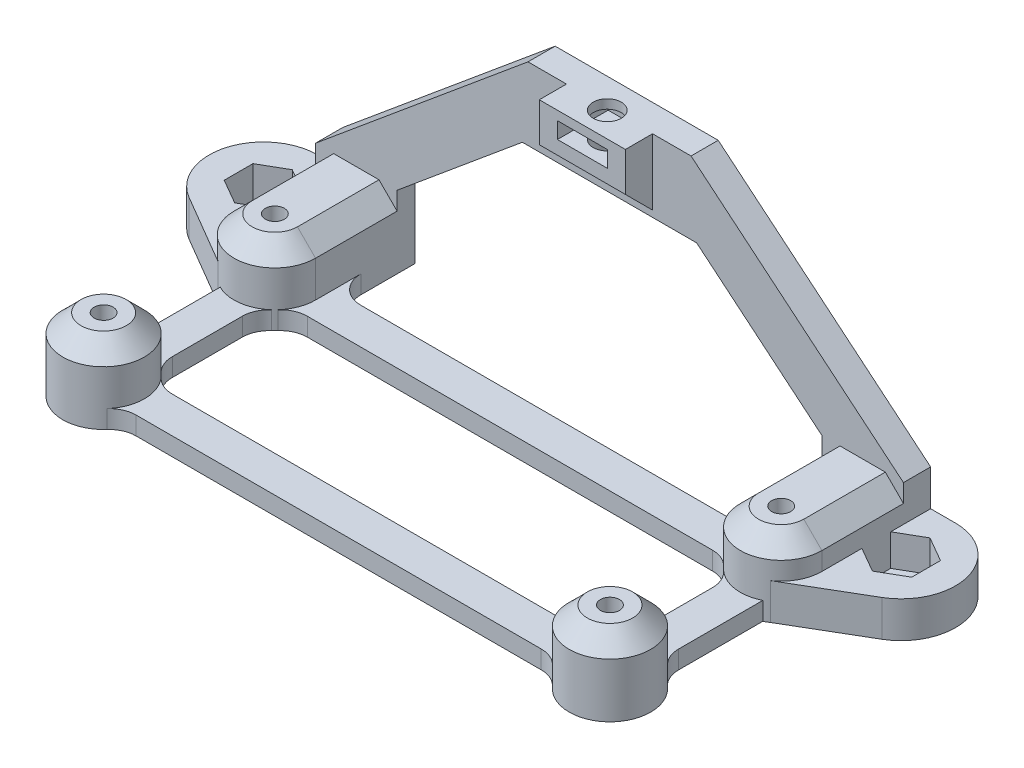
from build123d import *

# Parameters (mm, degrees)
SKETCH1_R             = 4.5
SKETCH1_R_2           = 1.05
BOSS_EXTRUDE1_DEPTH   = 8
BOSS_EXTRUDE1_2_DEPTH = 8
BOSS_EXTRUDE1_3_DEPTH = 8
BOSS_EXTRUDE1_4_DEPTH = 8
BOSS_EXTRUDE2_REACH   = 91.358
SKETCH2_W             = 3
SKETCH2_H             = 27.5
CUT_EXTRUDE1_DEPTH    = 54.46973443
SKETCH4_W             = 59.9
SKETCH4_H             = 22.9
SKETCH4_W_2           = 51.9
SKETCH4_H_2           = 14.9
BOSS_EXTRUDE3_DEPTH   = 2
SKETCH7_W             = 9.5
SKETCH7_H             = 3
BOSS_EXTRUDE5_DEPTH   = 4.3
CUT_EXTRUDE3_START    = -1
SKETCH8_W             = 5.5
SKETCH8_H             = 5.5
CUT_EXTRUDE3_DEPTH    = 1.8
CHAMFER3_SIZE         = 3
SKETCH9_R             = 1.55
CUT_EXTRUDE4_DEPTH    = 5.4
BOSS_EXTRUDE6_DEPTH   = 4
SKETCH11_R            = 1.5
BOSS_EXTRUDE7_DEPTH   = 0.5
FILLET2_R             = 3
CHAMFER4_SIZE         = 1
CHAMFER5_SIZE         = 2
SKETCH12_W            = 5.5
SKETCH12_H            = 1.8
CUT_EXTRUDE5_DEPTH    = 0.1


with BuildPart() as part:
    # Sketch1 → Boss-Extrude1 (new body)
    with BuildSketch(Plane(origin=(0, 0, 0), x_dir=(1, 0, 0), z_dir=(0, 1, 0))):
        with Locations(Location((27.95, -56.4, 0), (0, 0, 270))):
            Circle(SKETCH1_R)
        with Locations(Location((27.95, -56.4, 0), (0, 0, 270))):
            Circle(SKETCH1_R_2, mode=Mode.SUBTRACT)
    extrude(amount=BOSS_EXTRUDE1_DEPTH)



with BuildPart() as body_2:
    # Sketch1 → Boss-Extrude1 2 (new body)
    with BuildSketch(Plane(origin=(0, 0, 0), x_dir=(1, 0, 0), z_dir=(0, 1, 0))):
        with Locations(Location((-27.95, -56.4, 0), (0, 0, 270))):
            Circle(SKETCH1_R)
        with Locations(Location((-27.95, -56.4, 0), (0, 0, 270))):
            Circle(SKETCH1_R_2, mode=Mode.SUBTRACT)
    extrude(amount=BOSS_EXTRUDE1_2_DEPTH)


with BuildPart() as body_3:
    # Sketch1 → Boss-Extrude1 3 (new body)
    with BuildSketch(Plane(origin=(0, 0, 0), x_dir=(1, 0, 0), z_dir=(0, 1, 0))):
        with BuildLine():
            Line((-32.45, -37.5), (-32.45, -25.5))
            Line((-32.45, -25.5), (-23.45, -25.5))
            Line((-23.45, -25.5), (-23.45, -37.5))
            ThreePointArc((-23.45, -37.5), (-27.95, -42), (-32.45, -37.5))
        make_face()
        with Locations(Location((-27.95, -37.5, 0), (0, 0, 270))):
            Circle(SKETCH1_R_2, mode=Mode.SUBTRACT)
    extrude(amount=BOSS_EXTRUDE1_3_DEPTH)

    # Boss-Extrude2: up to this face of the body (flat: up to its plane)
    boss_extrude2_end = Plane(body_3.part.faces().sort_by_distance((-32.45, 4, 31.5))[0])
    # Sketch2 → Boss-Extrude2 (add, up to the picked face)
    with BuildSketch(Plane(origin=(32.45, 0, 0), x_dir=(0, 0, -1), z_dir=(1, 0, 0)), mode=Mode.PRIVATE) as boss_extrude2_sk1:
        with Locations((-27, 13.75)):
            Rectangle(SKETCH2_W, SKETCH2_H)
    boss_extrude2_tool1 = split(extrude(boss_extrude2_sk1.sketch, amount=-BOSS_EXTRUDE2_REACH, mode=Mode.PRIVATE), bisect_by=boss_extrude2_end, keep=Keep.BOTH, mode=Mode.PRIVATE)


with BuildPart() as body_4:
    # Sketch1 → Boss-Extrude1 4 (new body)
    with BuildSketch(Plane(origin=(0, 0, 0), x_dir=(1, 0, 0), z_dir=(0, 1, 0))):
        with BuildLine():
            Line((32.45, -37.5), (32.45, -25.5))
            Line((32.45, -25.5), (23.45, -25.5))
            Line((23.45, -25.5), (23.45, -37.5))
            ThreePointArc((23.45, -37.5), (27.95, -42), (32.45, -37.5))
        make_face()
        with Locations(Location((27.95, -37.5, 0), (0, 0, 270))):
            Circle(SKETCH1_R_2, mode=Mode.SUBTRACT)
    extrude(amount=BOSS_EXTRUDE1_4_DEPTH)


with BuildPart() as body_3_1:
    add(body_3.part)

    add(body_4.part)  # Boss-Extrude2 merges body 4
    add(boss_extrude2_tool1.solids().sort_by(Axis((32.45, 13.75, 27), (-1, 0, 0)))[0])

    # Sketch3 → Cut-Extrude1 (cut, through all)
    with BuildSketch(Plane.XY.offset(28.5)):
        Polygon((-32.45, 8), (-9, 27.5), (-32.45, 27.5), align=None)
        Polygon((9, 27.5), (32.45, 8), (32.45, 27.5), align=None)
        Polygon((-23.45, 8), (-23.45, 0), (23.45, 0), (23.45, 8), (9.620512821, 19.5), (-9.620512821, 19.5), align=None)
    extrude(amount=-CUT_EXTRUDE1_DEPTH, mode=Mode.SUBTRACT)


with BuildPart() as part_1:
    add(part.part)

    add(body_2.part)  # Boss-Extrude3 merges body 2

    add(body_3_1.part)  # Boss-Extrude3 merges body 3
    # Sketch4 → Boss-Extrude3 (add)
    with BuildSketch(Plane.XZ):
        with Locations((0, 46.95)):
            Rectangle(SKETCH4_W, SKETCH4_H)
        with Locations((0, 46.95)):
            Rectangle(SKETCH4_W_2, SKETCH4_H_2, mode=Mode.SUBTRACT)
    extrude(amount=-BOSS_EXTRUDE3_DEPTH)

    # Sketch7 → Boss-Extrude5 (add)
    with BuildSketch(Plane(origin=(0, 27.5, 0), x_dir=(1, 0, 0), z_dir=(0, 1, 0))):
        with Locations((0, -30)):
            Rectangle(SKETCH7_W, SKETCH7_H)
    extrude(amount=-BOSS_EXTRUDE5_DEPTH)

    # Sketch8 → Cut-Extrude3 (cut)
    with BuildSketch(Plane(origin=(0, 27.5, 0), x_dir=(1, 0, 0), z_dir=(0, 1, 0)).offset(CUT_EXTRUDE3_START)):
        with Locations((0, -28.75)):
            Rectangle(SKETCH8_W, SKETCH8_H)
    extrude(amount=-CUT_EXTRUDE3_DEPTH, mode=Mode.SUBTRACT)

    # Chamfer3
    chamfer3_edges = [part_1.edges().sort_by_distance(p)[0] for p in [
        (0, 23.2, 28.5),
    ]]
    chamfer(chamfer3_edges, length=CHAMFER3_SIZE - 0.0001)  # a hair under: the kernel refuses the full size

    # Sketch9 → Cut-Extrude4 (cut)
    with BuildSketch(Plane(origin=(0, 27.5, 0), x_dir=(1, 0, 0), z_dir=(0, 1, 0))):
        with Locations(Location((0, -28.75, 0), (0, 0, 270))):
            Circle(SKETCH9_R)
    extrude(amount=-CUT_EXTRUDE4_DEPTH, mode=Mode.SUBTRACT)

    # Sketch10 → Boss-Extrude6 (add)
    with BuildSketch(Plane.XZ):
        with BuildLine():
            Line((-32.45, 25.5), (-35.2, 25.5))
            ThreePointArc((-35.2, 25.5), (-40.990483074, 29.928279361), (-38.233673919, 36.676564744))
            Line((-38.233673919, 36.676564744), (-29.95, 41.531128874))
            Line((-29.95, 41.531128874), (-29.95, 25.5))
            Line((-29.95, 25.5), (-32.45, 25.5))
        make_face()
        Polygon((-35.2, 28.324573519), (-32.45, 29.91228676), (-32.45, 33.08771324), (-35.2, 34.675426481), (-37.95, 33.08771324), (-37.95, 29.91228676), align=None, mode=Mode.SUBTRACT)
    boss_extrude6 = extrude(amount=-BOSS_EXTRUDE6_DEPTH)

    # Sketch11 → Boss-Extrude7 (add)
    with BuildSketch(Plane.XZ):
        Polygon((-37.95, 33.08771324), (-37.95, 29.91228676), (-35.2, 28.324573519), (-32.45, 29.91228676), (-32.45, 33.08771324), (-35.2, 34.675426481), align=None)
        with Locations(Location((-35.2, 31.5, 0), (0, 0, 270))):
            Circle(SKETCH11_R, mode=Mode.SUBTRACT)
    boss_extrude7 = extrude(amount=-BOSS_EXTRUDE7_DEPTH)

    # Mirror1: Boss-Extrude6, Boss-Extrude7 across plane
    add(boss_extrude6.mirror(Plane(origin=(0, 0, 0), x_dir=(0, 0, 1), z_dir=(1, 0, 0))))
    add(boss_extrude7.mirror(Plane(origin=(0, 0, 0), x_dir=(0, 0, 1), z_dir=(1, 0, 0))))

    # Fillet2
    fillet2_edges = [part_1.edges().sort_by_distance(p)[0] for p in [
        (23.918871126, 1, 58.4),
        (-25.95, 1, 52.368871126),
        (-23.918871126, 1, 58.4),
        (-29.95, 1, 52.368871126),
        (-23.918871126, 1, 54.4),
        (23.918871126, 1, 39.5),
        (-23.918871126, 1, 39.5),
        (23.45, 1, 35.5),
        (-23.45, 1, 35.5),
        (25.95, 1, 52.368871126),
        (-25.95, 1, 41.531128874),
        (29.95, 1, 52.368871126),
        (25.95, 1, 41.531128874),
        (23.918871126, 1, 54.4),
    ]]
    fillet(fillet2_edges, radius=FILLET2_R)

    # Chamfer4
    chamfer4_edges = [part_1.edges().sort_by_distance(p)[0] for p in [
        (23.45, 4, 25.5),
        (-23.45, 4, 25.5),
    ]]
    chamfer(chamfer4_edges, length=CHAMFER4_SIZE)

    # Chamfer5
    chamfer5_edges = [part_1.edges().sort_by_distance(p)[0] for p in [
        (27.95, 8, 51.9),
        (-27.95, 8, 51.9),
        (-32.45, 8, 33),
        (-27.95, 8, 42),
        (-23.45, 8, 33),
        (23.45, 8, 33),
        (27.95, 8, 42),
        (32.45, 8, 33),
    ]]
    chamfer(chamfer5_edges, length=CHAMFER5_SIZE)

    # Sketch12 → Cut-Extrude5 (cut)
    with BuildSketch(Plane.XY.offset(26)):
        with Locations((0, 25.6)):
            Rectangle(SKETCH12_W, SKETCH12_H)
    extrude(amount=-CUT_EXTRUDE5_DEPTH, mode=Mode.SUBTRACT)


solid = part_1.part
